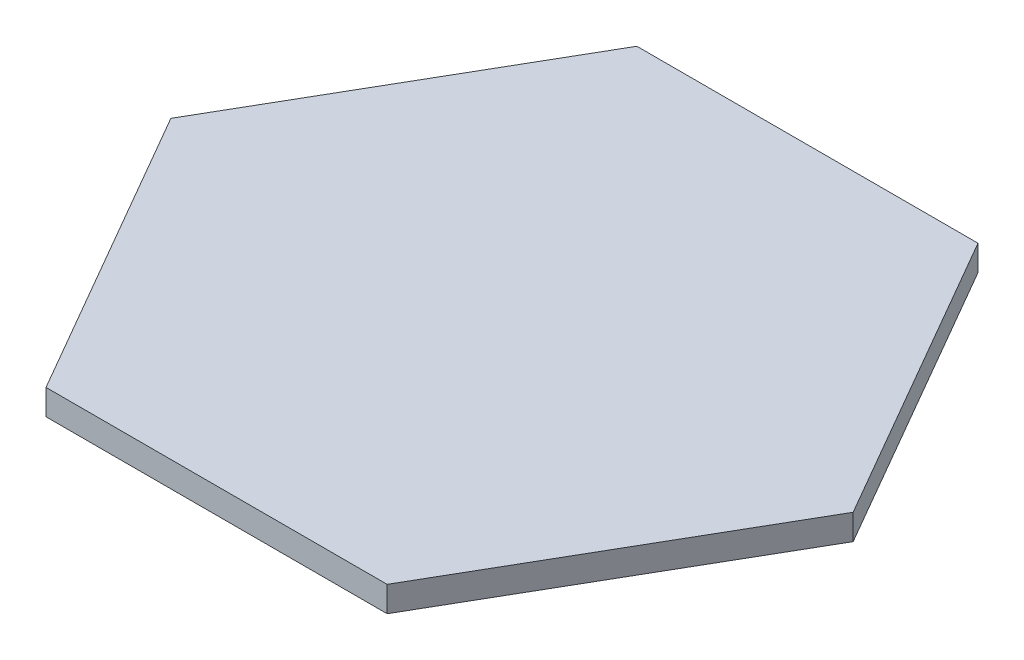
from build123d import *

# Parameters (mm, degrees)
BOSS_EXTRUDE1_DEPTH = 6.35


with BuildPart() as part:
    # Sketch1 → Boss-Extrude1 (new body)
    with BuildSketch(Plane(origin=(0, 0, 0), x_dir=(1, 0, 0), z_dir=(0, 1, 0))):
        Polygon((-42.526279442, -73.65767665), (42.526279442, -73.65767665), (85.052558883, 0), (42.526279442, 73.65767665), (-42.526279442, 73.65767665), (-85.052558883, 0), align=None)
    extrude(amount=BOSS_EXTRUDE1_DEPTH)


solid = part.part
